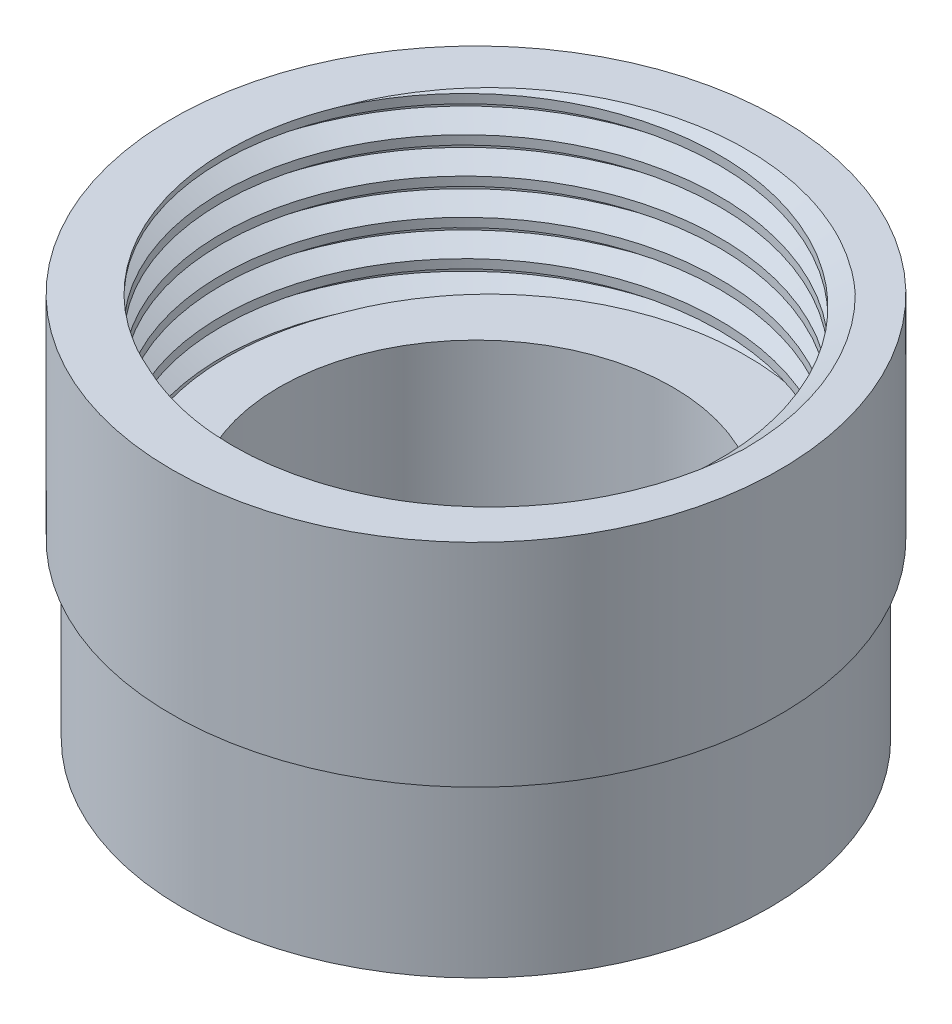
from build123d import *

# Parameters (mm, degrees)
SKETCH1_R           = 16.4
SKETCH1_R_2         = 11
BOSS_EXTRUDE1_DEPTH = 11.52173913
SKETCH2_R           = 17
SKETCH2_R_2         = 15
BOSS_EXTRUDE2_DEPTH = 10
BOSS_EXTRUDE3_START = 1.86
SKETCH3_R           = 17
SKETCH3_R_2         = 16.4
BOSS_EXTRUDE3_DEPTH = 1.86
THREAD3_PITCH       = 2
THREAD3_TO          = 12


with BuildPart() as part:
    # Sketch1 → Boss-Extrude1 (new body)
    with BuildSketch(Plane(origin=(0, 0, 0), x_dir=(1, 0, 0), z_dir=(0, 1, 0))):
        with Locations(Location((0, 0, 0), (0, 0, 270))):
            Circle(SKETCH1_R)
        with Locations(Location((0, 0, 0), (0, 0, 270))):
            Circle(SKETCH1_R_2, mode=Mode.SUBTRACT)
    extrude(amount=BOSS_EXTRUDE1_DEPTH)

    # Sketch2 → Boss-Extrude2 (add)
    with BuildSketch(Plane(origin=(0, 11.52173913, 0), x_dir=(1, 0, 0), z_dir=(0, 1, 0))):
        with Locations(Location((0, 0, 0), (0, 0, 270))):
            Circle(SKETCH2_R)
        with Locations(Location((0, 0, 0), (0, 0, 270))):
            Circle(SKETCH2_R_2, mode=Mode.SUBTRACT)
    extrude(amount=BOSS_EXTRUDE2_DEPTH)

    # Sketch3 → Boss-Extrude3 (add)
    with BuildSketch(Plane.XZ.offset(-11.52173913).offset(BOSS_EXTRUDE3_START)):
        with Locations(Location((0, 0, 0), (0, 0, 270))):
            Circle(SKETCH3_R)
        with Locations(Location((0, 0, 0), (0, 0, 270))):
            Circle(SKETCH3_R_2, mode=Mode.SUBTRACT)
    extrude(amount=-BOSS_EXTRUDE3_DEPTH)

    # Thread3: arcs per turn and ends read off the stored shape
    # Thread3: the profile of Thread Profile2 profile screwed along a right-hand helix through 10 turns, 10 arcs to a turn; built about Z, then put on its axis
    thread3_z = Axis((0, 0, 0), (0, 0, 1))
    thread3_corners = [(15.0003, 0, -0.000173205), (15.0003, 0, 1.7501732), (13.91746825, 0, 1.124999997), (13.91746825, 0, 0.624999997)]
    with BuildLine(mode=Mode.PRIVATE) as thread3_profile:
        Line(thread3_corners[0], thread3_corners[1])
        Line(thread3_corners[1], thread3_corners[2])
        Line(thread3_corners[2], thread3_corners[3])
        Line(thread3_corners[3], thread3_corners[0])
    thread3_cap = Face(thread3_profile.wire())
    thread3_turn_angles = [0, 18, 36, 54, 72, 90, 108, 126, 144, 162, 180, 198, 216, 234, 252, 270, 288, 306, 324, 342, 360]
    thread3_turn_weights = [1, 0.9510565162951535, 1, 0.9510565162951535, 1, 0.9510565162951535, 1, 0.9510565162951535, 1, 0.9510565162951535, 1, 0.9510565162951535, 1, 0.9510565162951535, 1, 0.9510565162951535, 1, 0.9510565162951535, 1, 0.9510565162951535, 1]
    thread3_turn_rails = [Edge.make_bspline([Vector(p[0], p[1], 0).rotate(thread3_z, thread3_turn_angles[k]) / thread3_turn_weights[k] + Vector(0, 0, p[2] + THREAD3_PITCH * thread3_turn_angles[k] / 360) for k in range(21)], [0, 0, 0, 1, 1, 2, 2, 3, 3, 4, 4, 5, 5, 6, 6, 7, 7, 8, 8, 9, 9, 10, 10, 10], 2, thread3_turn_weights) for p in thread3_corners]
    thread3_turn_sides = [Face.make_surface_from_curves(thread3_turn_rails[p[0]], thread3_turn_rails[p[1]]) for p in [(0, 1), (1, 2), (2, 3), (3, 0)]]
    thread3 = Plane(origin=(0, 9.52173913, 0), x_dir=(1, 0, 0), z_dir=(0, 1, 0)) * split(Solid(Shell([*[p.moved(Location((0, 0, THREAD3_PITCH * i))) for i in range(10) for p in thread3_turn_sides], thread3_cap, thread3_cap.rotate(thread3_z, 3600).moved(Location((0, 0, THREAD3_PITCH * 3600 / 360)))])), bisect_by=Plane.XY.offset(THREAD3_TO), keep=Keep.BOTTOM, mode=Mode.PRIVATE)
    add(thread3)


solid = part.part
